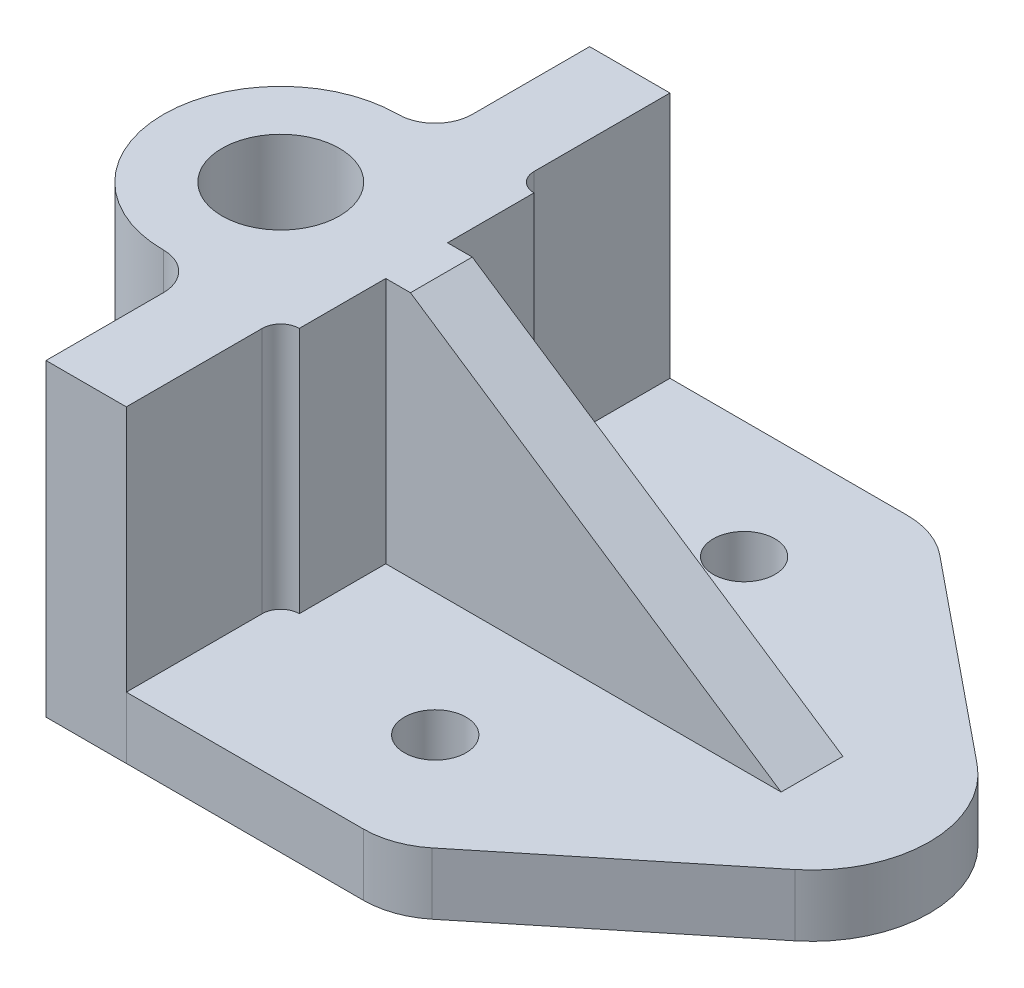
from build123d import *

# Parameters (mm, degrees)
SKETCH1_W               = 99
SKETCH1_H               = 88
SKETCH1_R               = 5
BOSS_EXTRUDE1_DEPTH     = 10
BOSS_EXTRUDE2_OUTLINE_R = 9.5
BOSS_EXTRUDE2_DEPTH     = 50
BOSS_EXTRUDE3_DEPTH     = 5
CUT_EXTRUDE3_DEPTH      = 10
FILLET1_R               = 13
FILLET2_R               = 13


# Read off the part's stored shape, not the designer's step: Boss-Extrude2
with BuildPart() as part:
    # Sketch1 → Boss-Extrude1 (new body)
    with BuildSketch(Plane(origin=(0, 0, 0), x_dir=(1, 0, 0), z_dir=(0, 1, 0))):
        with Locations((-3.690036969, 6.805517627)):
            Rectangle(SKETCH1_W, SKETCH1_H)
        with Locations(Location((-9.190036969, -18.194482373, 0), (0, 0, 270))):
            Circle(SKETCH1_R, mode=Mode.SUBTRACT)
        with Locations(Location((-9.190036969, 31.805517627, 0), (0, 0, 90))):
            Circle(SKETCH1_R, mode=Mode.SUBTRACT)
    extrude(amount=BOSS_EXTRUDE1_DEPTH)

    # Boss-Extrude2 outline → Boss-Extrude2 (add)
    with BuildSketch(Plane(origin=(0, 0, 0), x_dir=(1, 0, 0), z_dir=(0, 1, 0))):
        with BuildLine():
            ThreePointArc((-59.190036969, -12.203665814), (-54.947396282, -13.961025127), (-53.190036969, -18.203665814))
            Line((-53.190036969, -18.203665814), (-53.190036969, -37.203665814))
            Line((-53.190036969, -37.203665814), (-40.190036969, -37.203665814))
            Line((-40.190036969, -37.203665814), (-40.190036969, -15.203665814))
            ThreePointArc((-40.190036969, -15.203665814), (-39.311357313, -13.08234547), (-37.190036969, -12.203665814))
            Line((-37.190036969, -12.203665814), (-37.190036969, 1.796334186))
            Line((-37.190036969, 1.796334186), (-33.190036969, 1.796334186))
            Line((-33.190036969, 1.796334186), (-33.190036969, 11.796334186))
            Line((-33.190036969, 11.796334186), (-37.190036969, 11.796334186))
            Line((-37.190036969, 11.796334186), (-37.190036969, 25.796334186))
            ThreePointArc((-37.190036969, 25.796334186), (-39.311357313, 26.675013842), (-40.190036969, 28.796334186))
            Line((-40.190036969, 28.796334186), (-40.190036969, 50.796334186))
            Line((-40.190036969, 50.796334186), (-53.190036969, 50.796334186))
            Line((-53.190036969, 50.796334186), (-53.190036969, 31.796334186))
            ThreePointArc((-53.190036969, 31.796334186), (-54.947396282, 27.553693499), (-59.190036969, 25.796334186))
            ThreePointArc((-59.190036969, 25.796334186), (-78.190036969, 6.796334186), (-59.190036969, -12.203665814))
        make_face()
        with Locations((-59.190036969, 6.796334186)):
            Circle(BOSS_EXTRUDE2_OUTLINE_R, mode=Mode.SUBTRACT)
    extrude(amount=BOSS_EXTRUDE2_DEPTH)

    # 3DSketch2 → Boss-Extrude3 (add, symmetric)
    with BuildSketch(Plane(origin=(-33.190036969, 10, -6.796334186), x_dir=(1, 0, 0), z_dir=(0, 0, 1))):
        Polygon((0, 0), (60, 0), (0, 40), align=None)
    extrude(amount=BOSS_EXTRUDE3_DEPTH, both=True)

    # Sketch2 → Cut-Extrude3 (cut)
    with BuildSketch(Plane(origin=(0, 10, 0), x_dir=(1, 0, 0), z_dir=(0, 1, 0))):
        with BuildLine():
            ThreePointArc((38.793742347, 21.540492879), (43.966474405, 14.960601333), (45.809963031, 6.796430868))
            Line((45.809963031, 6.796430868), (45.809963031, 50.805517627))
            Line((45.809963031, 50.805517627), (2.809963031, 50.805517627))
            Line((2.809963031, 50.805517627), (38.793742347, 21.540492879))
        make_face()
        with BuildLine():
            Line((38.793742347, -7.947631063), (2.809963031, -37.194482373))
            Line((2.809963031, -37.194482373), (45.809963031, -37.194482373))
            Line((45.809963031, -37.194482373), (45.809963031, 6.796430868))
            ThreePointArc((45.809963031, 6.796430868), (43.966474387, -1.367739553), (38.793742347, -7.947631063))
        make_face()
    extrude(amount=-CUT_EXTRUDE3_DEPTH, mode=Mode.SUBTRACT)

    # Fillet1
    fillet1_edges = [part.edges().sort_by_distance(p)[0] for p in [
        (2.809963031, 5, 37.194482373),
    ]]
    fillet(fillet1_edges, radius=FILLET1_R)

    # Fillet2
    fillet2_edges = [part.edges().sort_by_distance(p)[0] for p in [
        (2.809963031, 5, -50.805517627),
    ]]
    fillet(fillet2_edges, radius=FILLET2_R)


solid = part.part
